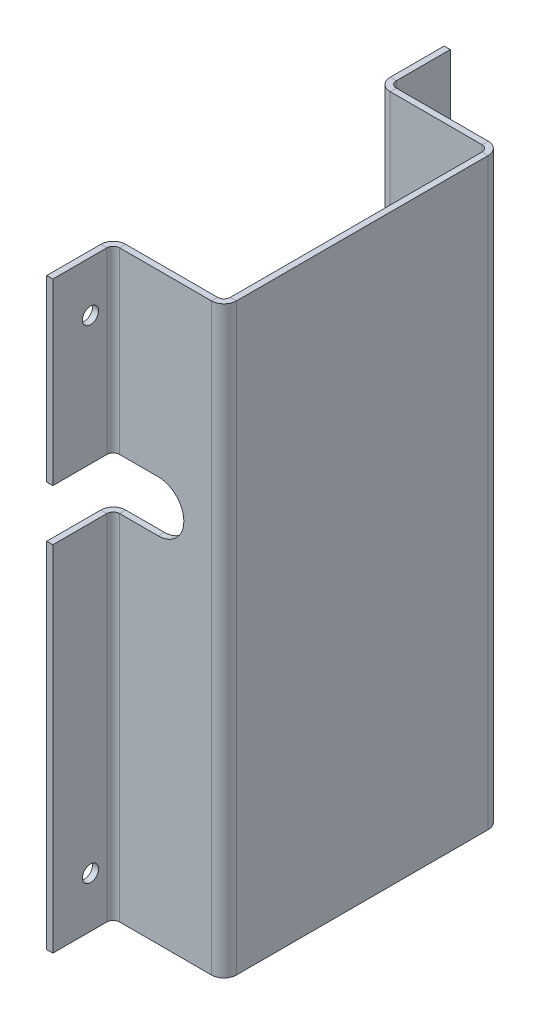
from build123d import *

# Parameters (mm, degrees)
SKETCH1_W                      = 125
SKETCH1_H                      = 290
BASE_FLANGE1_DEPTH             = 3.03784
EDGE_FLANGE1_DEPTH             = 290
EDGE_FLANGE1_BEND_DEPTH        = 290
EDGE_FLANGE2_STRIP_W           = 18.50136
EDGE_FLANGE2_STRIP_H           = 3.03784
EDGE_FLANGE2_STRIP_CUT_DEPTH   = 290
EDGE_FLANGE2_STRIP_2_W         = 18.50136
EDGE_FLANGE2_STRIP_2_H         = 3.03784
EDGE_FLANGE2_STRIP_CUT_2_DEPTH = 290
EDGE_FLANGE2_DEPTH             = 290
EDGE_FLANGE2_BEND_DEPTH        = 290
M6_CLEARANCE_HOLE1_D           = 8
CUT_EXTRUDE1_DEPTH             = 50


# Sheet-metal steps are written as plain solids
with BuildPart() as part:
    # Sketch1 → Base-Flange1 (new body)
    with BuildSketch(Plane(origin=(0, 0, 0), x_dir=(0, 0, -1), z_dir=(1, 0, 0))):
        Rectangle(SKETCH1_W, SKETCH1_H)
    extrude(amount=-BASE_FLANGE1_DEPTH)

    # Edge-Flange1 section (across the edge) → Edge-Flange1 (add)
    with BuildSketch(Plane(origin=(-3.03784, -145, 65.675), x_dir=(0, 0, -1), z_dir=(0, 1, 0))):
        with BuildLine():
            Line((-3.03784, 3.175), (-3.03784, 55))
            Line((-3.03784, 55), (0, 55))
            Line((0, 55), (0, 3.175))
            ThreePointArc((0, 3.175), (0.92993597, 0.92993597), (3.175, 0))
            Line((3.175, 0), (3.175, -3.03784))
            ThreePointArc((3.175, -3.03784), (-1.218141294, -1.218141294), (-3.03784, 3.175))
        make_face()
    extrude(amount=EDGE_FLANGE1_DEPTH)

    # Edge-Flange1 section 2 (across the edge) → Edge-Flange1 bend (add)
    with BuildSketch(Plane(origin=(-3.03784, 145, -65.675), x_dir=(0, 0, 1), z_dir=(0, -1, 0))):
        with BuildLine():
            Line((-3.03784, 3.175), (-3.03784, 55))
            Line((-3.03784, 55), (0, 55))
            Line((0, 55), (0, 3.175))
            ThreePointArc((0, 3.175), (0.92993597, 0.92993597), (3.175, 0))
            Line((3.175, 0), (3.175, -3.03784))
            ThreePointArc((3.175, -3.03784), (-1.218141294, -1.218141294), (-3.03784, 3.175))
        make_face()
    extrude(amount=EDGE_FLANGE1_BEND_DEPTH)

    # Edge-Flange2 strip (across the edge) → Edge-Flange2 strip cut (cut)
    with BuildSketch(Plane(origin=(-58.03784, -145, -68.71284), x_dir=(1, 0, 0), z_dir=(0, 1, 0))):
        with Locations((-3.03784, -1.51892)):
            Rectangle(EDGE_FLANGE2_STRIP_W, EDGE_FLANGE2_STRIP_H)
    extrude(amount=EDGE_FLANGE2_STRIP_CUT_DEPTH, mode=Mode.SUBTRACT)

    # Edge-Flange2 strip 2 (across the edge) → Edge-Flange2 strip cut 2 (cut)
    with BuildSketch(Plane(origin=(-58.03784, 145, 68.71284), x_dir=(1, 0, 0), z_dir=(0, -1, 0))):
        with Locations((-3.03784, -1.51892)):
            Rectangle(EDGE_FLANGE2_STRIP_2_W, EDGE_FLANGE2_STRIP_2_H)
    extrude(amount=EDGE_FLANGE2_STRIP_CUT_2_DEPTH, mode=Mode.SUBTRACT)

    # Edge-Flange2 section (across the edge) → Edge-Flange2 (add)
    with BuildSketch(Plane(origin=(-58.03784, -145, -68.71284), x_dir=(1, 0, 0), z_dir=(0, 1, 0))):
        with BuildLine():
            Line((0, 3.175), (0, 30))
            Line((0, 30), (3.03784, 30))
            Line((3.03784, 30), (3.03784, 3.175))
            ThreePointArc((3.03784, 3.175), (3.96777597, 0.92993597), (6.21284, 0))
            Line((6.21284, 0), (6.21284, -3.03784))
            ThreePointArc((6.21284, -3.03784), (1.819698706, -1.218141294), (0, 3.175))
        make_face()
    extrude(amount=EDGE_FLANGE2_DEPTH)

    # Edge-Flange2 section 2 (across the edge) → Edge-Flange2 bend (add)
    with BuildSketch(Plane(origin=(-58.03784, 145, 68.71284), x_dir=(1, 0, 0), z_dir=(0, -1, 0))):
        with BuildLine():
            Line((0, 3.175), (0, 30))
            Line((0, 30), (3.03784, 30))
            Line((3.03784, 30), (3.03784, 3.175))
            ThreePointArc((3.03784, 3.175), (3.96777597, 0.92993597), (6.21284, 0))
            Line((6.21284, 0), (6.21284, -3.03784))
            ThreePointArc((6.21284, -3.03784), (1.819698706, -1.218141294), (0, 3.175))
        make_face()
    extrude(amount=EDGE_FLANGE2_BEND_DEPTH)

    # M6 Clearance Hole1 (through all)
    with Locations(Plane(origin=(-55, 0, 0), x_dir=(0, 0, -1), z_dir=(1, 0, 0))):
        with Locations((-80, 120), (80, 120), (80, -120), (-80, -120)):
            Hole(M6_CLEARANCE_HOLE1_D / 2)

    # Sketch20 → Cut-Extrude1 (cut)
    with BuildSketch(Plane.XY.offset(98.71284)):
        with BuildLine():
            Line((-58.03784, 56.1), (-32.63784, 56.1))
            ThreePointArc((-32.63784, 56.1), (-19.93784, 43.4), (-32.63784, 30.7))
            Line((-32.63784, 30.7), (-58.03784, 30.7))
            Line((-58.03784, 30.7), (-58.03784, 56.1))
        make_face()
    extrude(amount=-CUT_EXTRUDE1_DEPTH, mode=Mode.SUBTRACT)


solid = part.part
